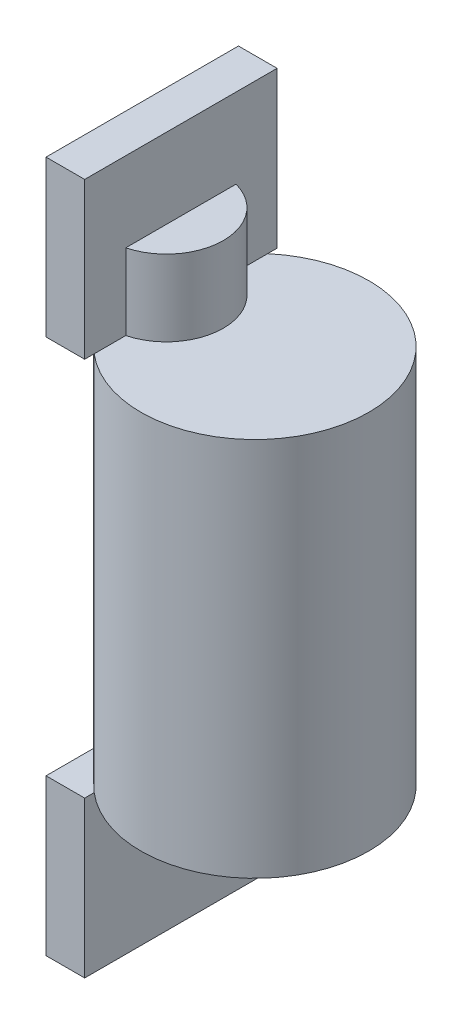
from build123d import *

# Parameters (mm, degrees)
SKETCH_1_R      = 3
EXTRUDE_1_DEPTH = 10
SKETCH_5_W      = 1.016865797
SKETCH_5_H      = 5.06336268
EXTRUDE_3_DEPTH = 4.1
SKETCH_3_R      = 1.5
EXTRUDE_2_DEPTH = 2


with BuildPart() as part:
    # Эскиз1 → Бобышка-Вытянуть1 (new body)
    with BuildSketch(Plane(origin=(0, 0, 0), x_dir=(1, 0, 0), z_dir=(0, 1, 0))):
        Circle(SKETCH_1_R)
    extrude(amount=EXTRUDE_1_DEPTH)

    # Эскиз5 → Бобышка-Вытянуть3 (add)
    with BuildSketch(Plane(origin=(0, 10, 0), x_dir=(1, 0, 0), z_dir=(0, 1, 0))):
        with Locations((-2.455678484, 0)):
            Rectangle(SKETCH_5_W, SKETCH_5_H)
    extrude_3 = extrude(amount=EXTRUDE_3_DEPTH)

    # Зеркальное отражение1: Бобышка-Вытянуть3 across plane
    add(extrude_3.mirror(Plane.ZX.offset(5)))

    # Эскиз3 → Бобышка-Вытянуть2 (add)
    with BuildSketch(Plane(origin=(0, 10, 0), x_dir=(1, 0, 0), z_dir=(0, 1, 0))):
        with Locations((-2.329880654, 0)):
            Circle(SKETCH_3_R)
    extrude(amount=EXTRUDE_2_DEPTH)


solid = part.part
